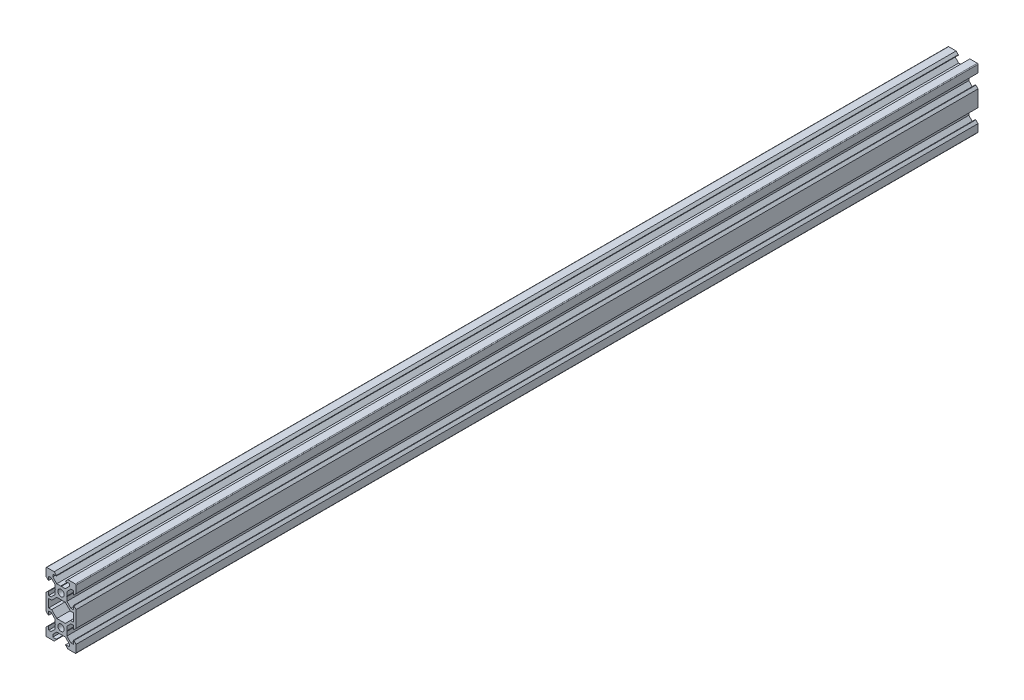
from build123d import *

# Parameters (mm, degrees)
V_SLOT_START                           = -54.690570378
V_SLOT_20X40X500_LINEAR_RAIL_OUTLINE_R = 2.1
V_SLOT_20X40X500_LINEAR_RAIL_DEPTH     = 500
BOSS_EXTRUDE2_START                    = 100
SKETCH1_R                              = 2.1
BOSS_EXTRUDE2_DEPTH                    = 100


# Read off the part's stored shape, not the designer's step: V-Slot 20x40x500 Linear Rail
with BuildPart() as part:
    # V-Slot 20x40x500 Linear Rail outline → V-Slot 20x40x500 Linear Rail (new body)
    with BuildSketch(Plane.XY.offset(V_SLOT_START)):
        with BuildLine():
            Line((29.12819476, 68.065715692), (29.12819476, 70.69505552))
            Line((29.12819476, 70.69505552), (28.91819476, 70.90505552))
            Line((28.91819476, 70.90505552), (29.12819476, 71.11505552))
            Line((29.12819476, 71.11505552), (29.12819476, 73.744395348))
            Line((29.12819476, 73.744395348), (31.788854932, 76.40505552))
            Line((31.788854932, 76.40505552), (33.42819476, 76.40505552))
            Line((33.42819476, 76.40505552), (33.42819476, 74.03005552))
            Line((33.42819476, 74.03005552), (33.77319476, 74.03005552))
            Line((33.77319476, 74.03005552), (35.22819476, 75.48505552))
            Line((35.22819476, 75.48505552), (35.22819476, 80.40505552))
            ThreePointArc((35.22819476, 80.40505552), (35.08174815, 80.758608911), (34.72819476, 80.90505552))
            Line((34.72819476, 80.90505552), (29.80819476, 80.90505552))
            Line((29.80819476, 80.90505552), (28.35319476, 79.45005552))
            Line((28.35319476, 79.45005552), (28.35319476, 79.10505552))
            Line((28.35319476, 79.10505552), (30.72819476, 79.10505552))
            Line((30.72819476, 79.10505552), (30.72819476, 77.465715692))
            Line((30.72819476, 77.465715692), (28.067534588, 74.80505552))
            Line((28.067534588, 74.80505552), (25.43819476, 74.80505552))
            Line((25.43819476, 74.80505552), (25.22819476, 74.59505552))
            Line((25.22819476, 74.59505552), (25.01819476, 74.80505552))
            Line((25.01819476, 74.80505552), (22.388854932, 74.80505552))
            Line((22.388854932, 74.80505552), (19.72819476, 77.465715692))
            Line((19.72819476, 77.465715692), (19.72819476, 79.10505552))
            Line((19.72819476, 79.10505552), (22.10319476, 79.10505552))
            Line((22.10319476, 79.10505552), (22.10319476, 79.45005552))
            Line((22.10319476, 79.45005552), (20.64819476, 80.90505552))
            Line((20.64819476, 80.90505552), (15.72819476, 80.90505552))
            ThreePointArc((15.72819476, 80.90505552), (15.374641369, 80.758608911), (15.22819476, 80.40505552))
            Line((15.22819476, 80.40505552), (15.22819476, 75.48505552))
            Line((15.22819476, 75.48505552), (16.68319476, 74.03005552))
            Line((16.68319476, 74.03005552), (17.02819476, 74.03005552))
            Line((17.02819476, 74.03005552), (17.02819476, 76.40505552))
            Line((17.02819476, 76.40505552), (18.667534588, 76.40505552))
            Line((18.667534588, 76.40505552), (21.32819476, 73.744395348))
            Line((21.32819476, 73.744395348), (21.32819476, 71.11505552))
            Line((21.32819476, 71.11505552), (21.53819476, 70.90505552))
            Line((21.53819476, 70.90505552), (21.32819476, 70.69505552))
            Line((21.32819476, 70.69505552), (21.32819476, 68.065715692))
            Line((21.32819476, 68.065715692), (18.667534588, 65.40505552))
            Line((18.667534588, 65.40505552), (17.02819476, 65.40505552))
            Line((17.02819476, 65.40505552), (17.02819476, 67.78005552))
            Line((17.02819476, 67.78005552), (16.68319476, 67.78005552))
            Line((16.68319476, 67.78005552), (15.22819476, 66.32505552))
            Line((15.22819476, 66.32505552), (15.22819476, 55.48505552))
            Line((15.22819476, 55.48505552), (16.68319476, 54.03005552))
            Line((16.68319476, 54.03005552), (17.02819476, 54.03005552))
            Line((17.02819476, 54.03005552), (17.02819476, 56.40505552))
            Line((17.02819476, 56.40505552), (18.667534588, 56.40505552))
            Line((18.667534588, 56.40505552), (21.32819476, 53.744395348))
            Line((21.32819476, 53.744395348), (21.32819476, 51.11505552))
            Line((21.32819476, 51.11505552), (21.53819476, 50.90505552))
            Line((21.53819476, 50.90505552), (21.32819476, 50.69505552))
            Line((21.32819476, 50.69505552), (21.32819476, 48.065715692))
            Line((21.32819476, 48.065715692), (18.667534588, 45.40505552))
            Line((18.667534588, 45.40505552), (17.02819476, 45.40505552))
            Line((17.02819476, 45.40505552), (17.02819476, 47.78005552))
            Line((17.02819476, 47.78005552), (16.68319476, 47.78005552))
            Line((16.68319476, 47.78005552), (15.22819476, 46.32505552))
            Line((15.22819476, 46.32505552), (15.22819476, 41.40505552))
            ThreePointArc((15.22819476, 41.40505552), (15.37464137, 41.05150213), (15.72819476, 40.90505552))
            Line((15.72819476, 40.90505552), (20.64819476, 40.90505552))
            Line((20.64819476, 40.90505552), (22.10319476, 42.36005552))
            Line((22.10319476, 42.36005552), (22.10319476, 42.70505552))
            Line((22.10319476, 42.70505552), (19.72819476, 42.70505552))
            Line((19.72819476, 42.70505552), (19.72819476, 44.344395348))
            Line((19.72819476, 44.344395348), (22.388854932, 47.00505552))
            Line((22.388854932, 47.00505552), (25.01819476, 47.00505552))
            Line((25.01819476, 47.00505552), (25.22819476, 47.21505552))
            Line((25.22819476, 47.21505552), (25.43819476, 47.00505552))
            Line((25.43819476, 47.00505552), (28.067534588, 47.00505552))
            Line((28.067534588, 47.00505552), (30.72819476, 44.344395348))
            Line((30.72819476, 44.344395348), (30.72819476, 42.70505552))
            Line((30.72819476, 42.70505552), (28.35319476, 42.70505552))
            Line((28.35319476, 42.70505552), (28.35319476, 42.36005552))
            Line((28.35319476, 42.36005552), (29.80819476, 40.90505552))
            Line((29.80819476, 40.90505552), (34.72819476, 40.90505552))
            ThreePointArc((34.72819476, 40.90505552), (35.08174815, 41.05150213), (35.22819476, 41.40505552))
            Line((35.22819476, 41.40505552), (35.22819476, 46.32505552))
            Line((35.22819476, 46.32505552), (33.77319476, 47.78005552))
            Line((33.77319476, 47.78005552), (33.42819476, 47.78005552))
            Line((33.42819476, 47.78005552), (33.42819476, 45.40505552))
            Line((33.42819476, 45.40505552), (31.788854932, 45.40505552))
            Line((31.788854932, 45.40505552), (29.12819476, 48.065715692))
            Line((29.12819476, 48.065715692), (29.12819476, 50.69505552))
            Line((29.12819476, 50.69505552), (28.91819476, 50.90505552))
            Line((28.91819476, 50.90505552), (29.12819476, 51.11505552))
            Line((29.12819476, 51.11505552), (29.12819476, 53.744395348))
            Line((29.12819476, 53.744395348), (31.788854932, 56.40505552))
            Line((31.788854932, 56.40505552), (33.42819476, 56.40505552))
            Line((33.42819476, 56.40505552), (33.42819476, 54.03005552))
            Line((33.42819476, 54.03005552), (33.77319476, 54.03005552))
            Line((33.77319476, 54.03005552), (35.22819476, 55.48505552))
            Line((35.22819476, 55.48505552), (35.22819476, 66.32505552))
            Line((35.22819476, 66.32505552), (33.77319476, 67.78005552))
            Line((33.77319476, 67.78005552), (33.42819476, 67.78005552))
            Line((33.42819476, 67.78005552), (33.42819476, 65.40505552))
            Line((33.42819476, 65.40505552), (31.788854932, 65.40505552))
            Line((31.788854932, 65.40505552), (29.12819476, 68.065715692))
        make_face()
        with Locations((25.22819476, 50.90505552)):
            Circle(V_SLOT_20X40X500_LINEAR_RAIL_OUTLINE_R, mode=Mode.SUBTRACT)
        Polygon((22.388854932, 54.80505552), (18.988854932, 58.20505552), (17.02819476, 58.20505552), (17.02819476, 63.60505552), (18.988854932, 63.60505552), (22.388854932, 67.00505552), (28.067534588, 67.00505552), (31.467534588, 63.60505552), (33.42819476, 63.60505552), (33.42819476, 58.20505552), (31.467534588, 58.20505552), (28.067534588, 54.80505552), align=None, mode=Mode.SUBTRACT)
        with Locations((25.22819476, 70.90505552)):
            Circle(V_SLOT_20X40X500_LINEAR_RAIL_OUTLINE_R, mode=Mode.SUBTRACT)
    extrude(amount=V_SLOT_20X40X500_LINEAR_RAIL_DEPTH)

    # Sketch1 → Boss-Extrude2 (add)
    with BuildSketch(Plane(origin=(0, 0, -54.690570378), x_dir=(-1, 0, 0), z_dir=(0, 0, -1)).offset(BOSS_EXTRUDE2_START)):
        with BuildLine():
            Line((-28.91819476, 70.90505552), (-29.12819476, 70.69505552))
            Line((-29.12819476, 70.69505552), (-29.12819476, 68.065715692))
            Line((-29.12819476, 68.065715692), (-31.788854932, 65.40505552))
            Line((-31.788854932, 65.40505552), (-33.42819476, 65.40505552))
            Line((-33.42819476, 65.40505552), (-33.42819476, 67.78005552))
            Line((-33.42819476, 67.78005552), (-33.77319476, 67.78005552))
            Line((-33.77319476, 67.78005552), (-35.22819476, 66.32505552))
            Line((-35.22819476, 66.32505552), (-35.22819476, 55.48505552))
            Line((-35.22819476, 55.48505552), (-33.77319476, 54.03005552))
            Line((-33.77319476, 54.03005552), (-33.42819476, 54.03005552))
            Line((-33.42819476, 54.03005552), (-33.42819476, 56.40505552))
            Line((-33.42819476, 56.40505552), (-31.788854932, 56.40505552))
            Line((-31.788854932, 56.40505552), (-29.12819476, 53.744395348))
            Line((-29.12819476, 53.744395348), (-29.12819476, 51.11505552))
            Line((-29.12819476, 51.11505552), (-28.91819476, 50.90505552))
            Line((-28.91819476, 50.90505552), (-29.12819476, 50.69505552))
            Line((-29.12819476, 50.69505552), (-29.12819476, 48.065715692))
            Line((-29.12819476, 48.065715692), (-31.788854932, 45.40505552))
            Line((-31.788854932, 45.40505552), (-33.42819476, 45.40505552))
            Line((-33.42819476, 45.40505552), (-33.42819476, 47.78005552))
            Line((-33.42819476, 47.78005552), (-33.77319476, 47.78005552))
            Line((-33.77319476, 47.78005552), (-35.22819476, 46.32505552))
            Line((-35.22819476, 46.32505552), (-35.22819476, 41.40505552))
            ThreePointArc((-35.22819476, 41.40505552), (-35.08174815, 41.05150213), (-34.72819476, 40.90505552))
            Line((-34.72819476, 40.90505552), (-29.80819476, 40.90505552))
            Line((-29.80819476, 40.90505552), (-28.35319476, 42.36005552))
            Line((-28.35319476, 42.36005552), (-28.35319476, 42.70505552))
            Line((-28.35319476, 42.70505552), (-30.72819476, 42.70505552))
            Line((-30.72819476, 42.70505552), (-30.72819476, 44.344395348))
            Line((-30.72819476, 44.344395348), (-28.067534588, 47.00505552))
            Line((-28.067534588, 47.00505552), (-25.43819476, 47.00505552))
            Line((-25.43819476, 47.00505552), (-25.22819476, 47.21505552))
            Line((-25.22819476, 47.21505552), (-25.01819476, 47.00505552))
            Line((-25.01819476, 47.00505552), (-22.388854932, 47.00505552))
            Line((-22.388854932, 47.00505552), (-19.72819476, 44.344395348))
            Line((-19.72819476, 44.344395348), (-19.72819476, 42.70505552))
            Line((-19.72819476, 42.70505552), (-22.10319476, 42.70505552))
            Line((-22.10319476, 42.70505552), (-22.10319476, 42.36005552))
            Line((-22.10319476, 42.36005552), (-20.64819476, 40.90505552))
            Line((-20.64819476, 40.90505552), (-15.72819476, 40.90505552))
            ThreePointArc((-15.72819476, 40.90505552), (-15.374641369, 41.05150213), (-15.22819476, 41.40505552))
            Line((-15.22819476, 41.40505552), (-15.22819476, 46.32505552))
            Line((-15.22819476, 46.32505552), (-16.68319476, 47.78005552))
            Line((-16.68319476, 47.78005552), (-17.02819476, 47.78005552))
            Line((-17.02819476, 47.78005552), (-17.02819476, 45.40505552))
            Line((-17.02819476, 45.40505552), (-18.667534588, 45.40505552))
            Line((-18.667534588, 45.40505552), (-21.32819476, 48.065715692))
            Line((-21.32819476, 48.065715692), (-21.32819476, 50.69505552))
            Line((-21.32819476, 50.69505552), (-21.53819476, 50.90505552))
            Line((-21.53819476, 50.90505552), (-21.32819476, 51.11505552))
            Line((-21.32819476, 51.11505552), (-21.32819476, 53.744395348))
            Line((-21.32819476, 53.744395348), (-18.667534588, 56.40505552))
            Line((-18.667534588, 56.40505552), (-17.02819476, 56.40505552))
            Line((-17.02819476, 56.40505552), (-17.02819476, 54.03005552))
            Line((-17.02819476, 54.03005552), (-16.68319476, 54.03005552))
            Line((-16.68319476, 54.03005552), (-15.22819476, 55.48505552))
            Line((-15.22819476, 55.48505552), (-15.22819476, 66.32505552))
            Line((-15.22819476, 66.32505552), (-16.68319476, 67.78005552))
            Line((-16.68319476, 67.78005552), (-17.02819476, 67.78005552))
            Line((-17.02819476, 67.78005552), (-17.02819476, 65.40505552))
            Line((-17.02819476, 65.40505552), (-18.667534588, 65.40505552))
            Line((-18.667534588, 65.40505552), (-21.32819476, 68.065715692))
            Line((-21.32819476, 68.065715692), (-21.32819476, 70.69505552))
            Line((-21.32819476, 70.69505552), (-21.53819476, 70.90505552))
            Line((-21.53819476, 70.90505552), (-21.32819476, 71.11505552))
            Line((-21.32819476, 71.11505552), (-21.32819476, 73.744395348))
            Line((-21.32819476, 73.744395348), (-18.667534588, 76.40505552))
            Line((-18.667534588, 76.40505552), (-17.02819476, 76.40505552))
            Line((-17.02819476, 76.40505552), (-17.02819476, 74.03005552))
            Line((-17.02819476, 74.03005552), (-16.68319476, 74.03005552))
            Line((-16.68319476, 74.03005552), (-15.22819476, 75.48505552))
            Line((-15.22819476, 75.48505552), (-15.22819476, 80.40505552))
            ThreePointArc((-15.22819476, 80.40505552), (-15.374641369, 80.758608911), (-15.72819476, 80.90505552))
            Line((-15.72819476, 80.90505552), (-20.64819476, 80.90505552))
            Line((-20.64819476, 80.90505552), (-22.10319476, 79.45005552))
            Line((-22.10319476, 79.45005552), (-22.10319476, 79.10505552))
            Line((-22.10319476, 79.10505552), (-19.72819476, 79.10505552))
            Line((-19.72819476, 79.10505552), (-19.72819476, 77.465715692))
            Line((-19.72819476, 77.465715692), (-22.388854932, 74.80505552))
            Line((-22.388854932, 74.80505552), (-25.01819476, 74.80505552))
            Line((-25.01819476, 74.80505552), (-25.22819476, 74.59505552))
            Line((-25.22819476, 74.59505552), (-25.43819476, 74.80505552))
            Line((-25.43819476, 74.80505552), (-28.067534588, 74.80505552))
            Line((-28.067534588, 74.80505552), (-30.72819476, 77.465715692))
            Line((-30.72819476, 77.465715692), (-30.72819476, 79.10505552))
            Line((-30.72819476, 79.10505552), (-28.35319476, 79.10505552))
            Line((-28.35319476, 79.10505552), (-28.35319476, 79.45005552))
            Line((-28.35319476, 79.45005552), (-29.80819476, 80.90505552))
            Line((-29.80819476, 80.90505552), (-34.72819476, 80.90505552))
            ThreePointArc((-34.72819476, 80.90505552), (-35.08174815, 80.758608911), (-35.22819476, 80.40505552))
            Line((-35.22819476, 80.40505552), (-35.22819476, 75.48505552))
            Line((-35.22819476, 75.48505552), (-33.77319476, 74.03005552))
            Line((-33.77319476, 74.03005552), (-33.42819476, 74.03005552))
            Line((-33.42819476, 74.03005552), (-33.42819476, 76.40505552))
            Line((-33.42819476, 76.40505552), (-31.788854932, 76.40505552))
            Line((-31.788854932, 76.40505552), (-29.12819476, 73.744395348))
            Line((-29.12819476, 73.744395348), (-29.12819476, 71.11505552))
            Line((-29.12819476, 71.11505552), (-28.91819476, 70.90505552))
        make_face()
        with Locations((-25.22819476, 50.90505552)):
            Circle(SKETCH1_R, mode=Mode.SUBTRACT)
        with Locations((-25.22819476, 70.90505552)):
            Circle(SKETCH1_R, mode=Mode.SUBTRACT)
        Polygon((-18.988854932, 63.60505552), (-22.388854932, 67.00505552), (-28.067534588, 67.00505552), (-31.467534588, 63.60505552), (-33.42819476, 63.60505552), (-33.42819476, 58.20505552), (-31.467534588, 58.20505552), (-28.067534588, 54.80505552), (-22.388854932, 54.80505552), (-18.988854932, 58.20505552), (-17.02819476, 58.20505552), (-17.02819476, 63.60505552), align=None, mode=Mode.SUBTRACT)
    extrude(amount=-BOSS_EXTRUDE2_DEPTH)


solid = part.part
